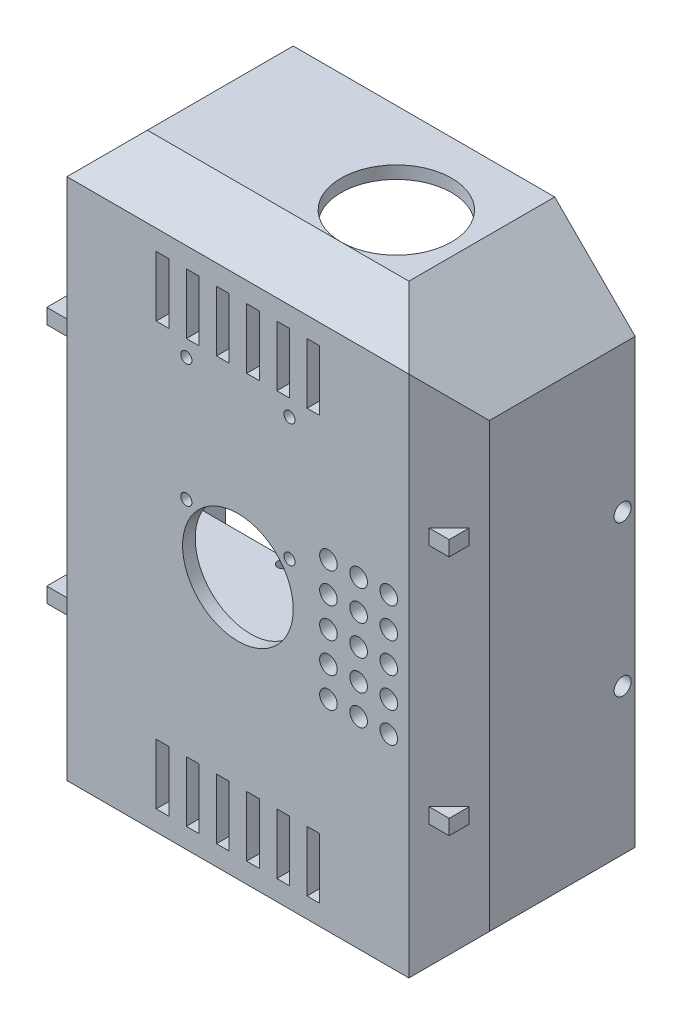
from build123d import *

# Parameters (mm, degrees)
BOSS_1_DEPTH    = 37
CUT_2_DEPTH     = 86
CUT_3_DEPTH     = 86
CUT_4_DEPTH     = 122
CUT_5_DEPTH     = 122
CUT_6_DEPTH     = 26.6
CUT_7_DEPTH     = 4.1
CUT_8_DEPTH     = 4.1
S_HOLE9_R       = 11
HOLE_9_DEPTH    = 2.7
S_CUT10_W       = 2.5
S_CUT10_H       = 12
POCKET_10_DEPTH = 2.7
S_CUT11_W       = 2.5
S_CUT11_H       = 12
POCKET_11_DEPTH = 2.7
S_CUT12_W       = 2.5
S_CUT12_H       = 12
POCKET_12_DEPTH = 2.7
S_CUT13_W       = 2.5
S_CUT13_H       = 12
POCKET_13_DEPTH = 2.7
S_CUT14_W       = 2.5
S_CUT14_H       = 12
POCKET_14_DEPTH = 2.7
S_CUT15_W       = 2.5
S_CUT15_H       = 12
POCKET_15_DEPTH = 2.7
S_HOLE16_R      = 1.7
HOLE_16_DEPTH   = 2.7
S_HOLE17_R      = 1.7
HOLE_17_DEPTH   = 2.7
S_HOLE18_R      = 11
HOLE_18_DEPTH   = 2.7
S_CUT19_W       = 2.5
S_CUT19_H       = 12
POCKET_19_DEPTH = 2.7
S_CUT20_W       = 2.5
S_CUT20_H       = 12
POCKET_20_DEPTH = 2.7
S_CUT21_W       = 2.5
S_CUT21_H       = 12
POCKET_21_DEPTH = 2.7
S_CUT22_W       = 2.5
S_CUT22_H       = 12
POCKET_22_DEPTH = 2.7
S_CUT23_W       = 2.5
S_CUT23_H       = 12
POCKET_23_DEPTH = 2.7
S_CUT24_W       = 2.5
S_CUT24_H       = 12
POCKET_24_DEPTH = 2.7
S_HOLE25_R      = 1.7
HOLE_25_DEPTH   = 2.7
S_HOLE26_R      = 1.7
HOLE_26_DEPTH   = 2.7
S_HOLE27_R      = 1.75
HOLE_27_DEPTH   = 2.7
S_HOLE28_R      = 1.75
HOLE_28_DEPTH   = 2.7
S_HOLE29_R      = 1.75
HOLE_29_DEPTH   = 2.7
S_HOLE30_R      = 1.75
HOLE_30_DEPTH   = 2.7
S_HOLE31_R      = 1.75
HOLE_31_DEPTH   = 2.7
S_HOLE32_R      = 1.75
HOLE_32_DEPTH   = 2.7
S_HOLE33_R      = 1.75
HOLE_33_DEPTH   = 2.7
S_HOLE34_R      = 1.75
HOLE_34_DEPTH   = 2.7
S_HOLE35_R      = 1.75
HOLE_35_DEPTH   = 2.7
S_HOLE36_R      = 1.75
HOLE_36_DEPTH   = 2.7
S_HOLE37_R      = 1.75
HOLE_37_DEPTH   = 2.7
S_HOLE38_R      = 1.75
HOLE_38_DEPTH   = 2.7
S_HOLE39_R      = 1.75
HOLE_39_DEPTH   = 2.7
S_HOLE40_R      = 1.75
HOLE_40_DEPTH   = 2.7
S_HOLE41_R      = 1.75
HOLE_41_DEPTH   = 2.7
S_HOLE42_R      = 11
HOLE_42_DEPTH   = 2.7
S_HOLE43_R      = 1.1
HOLE_43_DEPTH   = 2.7
S_HOLE44_R      = 1.1
HOLE_44_DEPTH   = 2.7
S_HOLE45_R      = 1.1
HOLE_45_DEPTH   = 2.7
S_HOLE46_R      = 1.1
HOLE_46_DEPTH   = 2.7
S_BOX47_W       = 80
S_BOX47_H       = 3
BOSS_47_DEPTH   = 28.5
S_BOX48_W       = 80
S_BOX48_H       = 3
BOSS_48_DEPTH   = 28.5
S_HOLE49_R      = 11
HOLE_49_DEPTH   = 3.2
S_HOLE50_R      = 1.1
HOLE_50_DEPTH   = 3.2
S_HOLE51_R      = 1.1
HOLE_51_DEPTH   = 3.2
S_HOLE52_R      = 1.1
HOLE_52_DEPTH   = 3.2
S_HOLE53_R      = 1.1
HOLE_53_DEPTH   = 3.2
S_HOLE54_R      = 11
HOLE_54_DEPTH   = 3.2
S_HOLE55_R      = 1.1
HOLE_55_DEPTH   = 3.2
S_HOLE56_R      = 1.1
HOLE_56_DEPTH   = 3.2
S_HOLE57_R      = 1.1
HOLE_57_DEPTH   = 3.2
S_HOLE58_R      = 1.1
HOLE_58_DEPTH   = 3.2


with BuildPart() as part:
    # S_prism1 → Boss_1 (new body)
    with BuildSketch(Plane.XY.offset(168)):
        Polygon((42, -44), (42, 44), (26, 60), (-26, 60), (-42, 44), (-42, -44), (-26, -60), (26, -60), align=None)
    extrude(amount=BOSS_1_DEPTH)

    # S_pcut2 → Cut_2 (cut)
    with BuildSketch(Plane(origin=(-43, 0, 0), x_dir=(0, 0, -1), z_dir=(1, 0, 0))):
        Polygon((-205.6, 60.6), (-205.6, 51.4), (-196.4, 60.6), align=None)
    extrude(amount=CUT_2_DEPTH, mode=Mode.SUBTRACT)

    # S_pcut3 → Cut_3 (cut)
    with BuildSketch(Plane(origin=(-43, 0, 0), x_dir=(0, 0, -1), z_dir=(1, 0, 0))):
        Polygon((-205.6, -60.6), (-205.6, -51.4), (-196.4, -60.6), align=None)
    extrude(amount=CUT_3_DEPTH, mode=Mode.SUBTRACT)

    # S_pcut4 → Cut_4 (cut)
    with BuildSketch(Plane(origin=(0, -61, 0), x_dir=(1, 0, 0), z_dir=(0, 1, 0))):
        Polygon((42.6, -205.6), (33.4, -205.6), (42.6, -196.4), align=None)
    extrude(amount=CUT_4_DEPTH, mode=Mode.SUBTRACT)

    # S_pcut5 → Cut_5 (cut)
    with BuildSketch(Plane(origin=(0, -61, 0), x_dir=(1, 0, 0), z_dir=(0, 1, 0))):
        Polygon((-42.6, -205.6), (-33.4, -205.6), (-42.6, -196.4), align=None)
    extrude(amount=CUT_5_DEPTH, mode=Mode.SUBTRACT)

    # S_pcut6 → Cut_6 (cut)
    with BuildSketch(Plane.XY.offset(167.9)):
        Polygon((39.5, -42.964466094), (39.5, 42.964466094), (24.964466094, 57.5), (-24.964466094, 57.5), (-39.5, 42.964466094), (-39.5, -42.964466094), (-24.964466094, -57.5), (24.964466094, -57.5), align=None)
    extrude(amount=CUT_6_DEPTH, mode=Mode.SUBTRACT)

    # S_pcut7 → Cut_7 (cut)
    with BuildSketch(Plane.XY.offset(194.4)):
        Polygon((35.5, -41.307611845), (35.5, 41.307611845), (23.307611845, 53.5), (-23.307611845, 53.5), (-35.5, 41.307611845), (-35.5, -41.307611845), (-23.307611845, -53.5), (23.307611845, -53.5), align=None)
    extrude(amount=CUT_7_DEPTH, mode=Mode.SUBTRACT)

    # S_pcut8 → Cut_8 (cut)
    with BuildSketch(Plane.XY.offset(198.4)):
        Polygon((31.5, -39.650757595), (31.5, 39.650757595), (21.650757595, 49.5), (-21.650757595, 49.5), (-31.5, 39.650757595), (-31.5, -39.650757595), (-21.650757595, -49.5), (21.650757595, -49.5), align=None)
    extrude(amount=CUT_8_DEPTH, mode=Mode.SUBTRACT)

    # S_hole9 → Hole_9 (cut)
    with BuildSketch(Plane(origin=(0, 57.4, 0), x_dir=(1, 0, 0), z_dir=(0, 1, 0))):
        with Locations((12.5, -186)):
            Circle(S_HOLE9_R)
    extrude(amount=HOLE_9_DEPTH, mode=Mode.SUBTRACT)

    # S_cut10 → Pocket_10 (cut)
    with BuildSketch(Plane.XY.offset(202.4)):
        with Locations((-15, 42)):
            Rectangle(S_CUT10_W, S_CUT10_H)
    extrude(amount=POCKET_10_DEPTH, mode=Mode.SUBTRACT)

    # S_cut11 → Pocket_11 (cut)
    with BuildSketch(Plane.XY.offset(202.4)):
        with Locations((-9, 42)):
            Rectangle(S_CUT11_W, S_CUT11_H)
    extrude(amount=POCKET_11_DEPTH, mode=Mode.SUBTRACT)

    # S_cut12 → Pocket_12 (cut)
    with BuildSketch(Plane.XY.offset(202.4)):
        with Locations((-3, 42)):
            Rectangle(S_CUT12_W, S_CUT12_H)
    extrude(amount=POCKET_12_DEPTH, mode=Mode.SUBTRACT)

    # S_cut13 → Pocket_13 (cut)
    with BuildSketch(Plane.XY.offset(202.4)):
        with Locations((3, 42)):
            Rectangle(S_CUT13_W, S_CUT13_H)
    extrude(amount=POCKET_13_DEPTH, mode=Mode.SUBTRACT)

    # S_cut14 → Pocket_14 (cut)
    with BuildSketch(Plane.XY.offset(202.4)):
        with Locations((9, 42)):
            Rectangle(S_CUT14_W, S_CUT14_H)
    extrude(amount=POCKET_14_DEPTH, mode=Mode.SUBTRACT)

    # S_cut15 → Pocket_15 (cut)
    with BuildSketch(Plane.XY.offset(202.4)):
        with Locations((15, 42)):
            Rectangle(S_CUT15_W, S_CUT15_H)
    extrude(amount=POCKET_15_DEPTH, mode=Mode.SUBTRACT)

    # S_hole16 → Hole_16 (cut)
    with BuildSketch(Plane(origin=(39.4, 0, 0), x_dir=(0, 0, -1), z_dir=(1, 0, 0))):
        with Locations((-170.5, -15)):
            Circle(S_HOLE16_R)
    extrude(amount=HOLE_16_DEPTH, mode=Mode.SUBTRACT)

    # S_hole17 → Hole_17 (cut)
    with BuildSketch(Plane(origin=(39.4, 0, 0), x_dir=(0, 0, -1), z_dir=(1, 0, 0))):
        with Locations((-170.5, 15)):
            Circle(S_HOLE17_R)
    extrude(amount=HOLE_17_DEPTH, mode=Mode.SUBTRACT)

    # S_hole18 → Hole_18 (cut)
    with BuildSketch(Plane(origin=(0, -60.1, 0), x_dir=(1, 0, 0), z_dir=(0, 1, 0))):
        with Locations((12.5, -186)):
            Circle(S_HOLE18_R)
    extrude(amount=HOLE_18_DEPTH, mode=Mode.SUBTRACT)

    # S_cut19 → Pocket_19 (cut)
    with BuildSketch(Plane.XY.offset(202.4)):
        with Locations((-15, -42)):
            Rectangle(S_CUT19_W, S_CUT19_H)
    extrude(amount=POCKET_19_DEPTH, mode=Mode.SUBTRACT)

    # S_cut20 → Pocket_20 (cut)
    with BuildSketch(Plane.XY.offset(202.4)):
        with Locations((-9, -42)):
            Rectangle(S_CUT20_W, S_CUT20_H)
    extrude(amount=POCKET_20_DEPTH, mode=Mode.SUBTRACT)

    # S_cut21 → Pocket_21 (cut)
    with BuildSketch(Plane.XY.offset(202.4)):
        with Locations((-3, -42)):
            Rectangle(S_CUT21_W, S_CUT21_H)
    extrude(amount=POCKET_21_DEPTH, mode=Mode.SUBTRACT)

    # S_cut22 → Pocket_22 (cut)
    with BuildSketch(Plane.XY.offset(202.4)):
        with Locations((3, -42)):
            Rectangle(S_CUT22_W, S_CUT22_H)
    extrude(amount=POCKET_22_DEPTH, mode=Mode.SUBTRACT)

    # S_cut23 → Pocket_23 (cut)
    with BuildSketch(Plane.XY.offset(202.4)):
        with Locations((9, -42)):
            Rectangle(S_CUT23_W, S_CUT23_H)
    extrude(amount=POCKET_23_DEPTH, mode=Mode.SUBTRACT)

    # S_cut24 → Pocket_24 (cut)
    with BuildSketch(Plane.XY.offset(202.4)):
        with Locations((15, -42)):
            Rectangle(S_CUT24_W, S_CUT24_H)
    extrude(amount=POCKET_24_DEPTH, mode=Mode.SUBTRACT)

    # S_hole25 → Hole_25 (cut)
    with BuildSketch(Plane(origin=(-42.1, 0, 0), x_dir=(0, 0, -1), z_dir=(1, 0, 0))):
        with Locations((-170.5, -15)):
            Circle(S_HOLE25_R)
    extrude(amount=HOLE_25_DEPTH, mode=Mode.SUBTRACT)

    # S_hole26 → Hole_26 (cut)
    with BuildSketch(Plane(origin=(-42.1, 0, 0), x_dir=(0, 0, -1), z_dir=(1, 0, 0))):
        with Locations((-170.5, 15)):
            Circle(S_HOLE26_R)
    extrude(amount=HOLE_26_DEPTH, mode=Mode.SUBTRACT)

    # S_hole27 → Hole_27 (cut)
    with BuildSketch(Plane.XY.offset(202.4)):
        with Locations((18, -12)):
            Circle(S_HOLE27_R)
    extrude(amount=HOLE_27_DEPTH, mode=Mode.SUBTRACT)

    # S_hole28 → Hole_28 (cut)
    with BuildSketch(Plane.XY.offset(202.4)):
        with Locations((18, -6)):
            Circle(S_HOLE28_R)
    extrude(amount=HOLE_28_DEPTH, mode=Mode.SUBTRACT)

    # S_hole29 → Hole_29 (cut)
    with BuildSketch(Plane.XY.offset(202.4)):
        with Locations((18, 0)):
            Circle(S_HOLE29_R)
    extrude(amount=HOLE_29_DEPTH, mode=Mode.SUBTRACT)

    # S_hole30 → Hole_30 (cut)
    with BuildSketch(Plane.XY.offset(202.4)):
        with Locations((18, 6)):
            Circle(S_HOLE30_R)
    extrude(amount=HOLE_30_DEPTH, mode=Mode.SUBTRACT)

    # S_hole31 → Hole_31 (cut)
    with BuildSketch(Plane.XY.offset(202.4)):
        with Locations((18, 12)):
            Circle(S_HOLE31_R)
    extrude(amount=HOLE_31_DEPTH, mode=Mode.SUBTRACT)

    # S_hole32 → Hole_32 (cut)
    with BuildSketch(Plane.XY.offset(202.4)):
        with Locations((24, -12)):
            Circle(S_HOLE32_R)
    extrude(amount=HOLE_32_DEPTH, mode=Mode.SUBTRACT)

    # S_hole33 → Hole_33 (cut)
    with BuildSketch(Plane.XY.offset(202.4)):
        with Locations((24, -6)):
            Circle(S_HOLE33_R)
    extrude(amount=HOLE_33_DEPTH, mode=Mode.SUBTRACT)

    # S_hole34 → Hole_34 (cut)
    with BuildSketch(Plane.XY.offset(202.4)):
        with Locations((24, 0)):
            Circle(S_HOLE34_R)
    extrude(amount=HOLE_34_DEPTH, mode=Mode.SUBTRACT)

    # S_hole35 → Hole_35 (cut)
    with BuildSketch(Plane.XY.offset(202.4)):
        with Locations((24, 6)):
            Circle(S_HOLE35_R)
    extrude(amount=HOLE_35_DEPTH, mode=Mode.SUBTRACT)

    # S_hole36 → Hole_36 (cut)
    with BuildSketch(Plane.XY.offset(202.4)):
        with Locations((24, 12)):
            Circle(S_HOLE36_R)
    extrude(amount=HOLE_36_DEPTH, mode=Mode.SUBTRACT)

    # S_hole37 → Hole_37 (cut)
    with BuildSketch(Plane.XY.offset(202.4)):
        with Locations((30, -12)):
            Circle(S_HOLE37_R)
    extrude(amount=HOLE_37_DEPTH, mode=Mode.SUBTRACT)

    # S_hole38 → Hole_38 (cut)
    with BuildSketch(Plane.XY.offset(202.4)):
        with Locations((30, -6)):
            Circle(S_HOLE38_R)
    extrude(amount=HOLE_38_DEPTH, mode=Mode.SUBTRACT)

    # S_hole39 → Hole_39 (cut)
    with BuildSketch(Plane.XY.offset(202.4)):
        with Locations((30, 0)):
            Circle(S_HOLE39_R)
    extrude(amount=HOLE_39_DEPTH, mode=Mode.SUBTRACT)

    # S_hole40 → Hole_40 (cut)
    with BuildSketch(Plane.XY.offset(202.4)):
        with Locations((30, 6)):
            Circle(S_HOLE40_R)
    extrude(amount=HOLE_40_DEPTH, mode=Mode.SUBTRACT)

    # S_hole41 → Hole_41 (cut)
    with BuildSketch(Plane.XY.offset(202.4)):
        with Locations((30, 12)):
            Circle(S_HOLE41_R)
    extrude(amount=HOLE_41_DEPTH, mode=Mode.SUBTRACT)

    # S_hole42 → Hole_42 (cut)
    with BuildSketch(Plane.XY.offset(202.4)):
        Circle(S_HOLE42_R)
    extrude(amount=HOLE_42_DEPTH, mode=Mode.SUBTRACT)

    # S_hole43 → Hole_43 (cut)
    with BuildSketch(Plane.XY.offset(202.4)):
        with Locations((-10.25, 8.3)):
            Circle(S_HOLE43_R)
    extrude(amount=HOLE_43_DEPTH, mode=Mode.SUBTRACT)

    # S_hole44 → Hole_44 (cut)
    with BuildSketch(Plane.XY.offset(202.4)):
        with Locations((10.25, 8.3)):
            Circle(S_HOLE44_R)
    extrude(amount=HOLE_44_DEPTH, mode=Mode.SUBTRACT)

    # S_hole45 → Hole_45 (cut)
    with BuildSketch(Plane.XY.offset(202.4)):
        with Locations((-10.25, 32.75)):
            Circle(S_HOLE45_R)
    extrude(amount=HOLE_45_DEPTH, mode=Mode.SUBTRACT)

    # S_hole46 → Hole_46 (cut)
    with BuildSketch(Plane.XY.offset(202.4)):
        with Locations((10.25, 32.75)):
            Circle(S_HOLE46_R)
    extrude(amount=HOLE_46_DEPTH, mode=Mode.SUBTRACT)

    # S_box47 → Boss_47 (add)
    with BuildSketch(Plane.XY.offset(174.5)):
        with Locations((0, 24)):
            Rectangle(S_BOX47_W, S_BOX47_H)
    extrude(amount=BOSS_47_DEPTH)

    # S_box48 → Boss_48 (add)
    with BuildSketch(Plane.XY.offset(174.5)):
        with Locations((0, -24)):
            Rectangle(S_BOX48_W, S_BOX48_H)
    extrude(amount=BOSS_48_DEPTH)

    # S_hole49 → Hole_49 (cut)
    with BuildSketch(Plane(origin=(0, 22.4, 0), x_dir=(1, 0, 0), z_dir=(0, 1, 0))):
        with Locations((12.5, -186)):
            Circle(S_HOLE49_R)
    extrude(amount=HOLE_49_DEPTH, mode=Mode.SUBTRACT)

    # S_hole50 → Hole_50 (cut)
    with BuildSketch(Plane(origin=(0, 22.4, 0), x_dir=(1, 0, 0), z_dir=(0, 1, 0))):
        with Locations((4.2, -175.75)):
            Circle(S_HOLE50_R)
    extrude(amount=HOLE_50_DEPTH, mode=Mode.SUBTRACT)

    # S_hole51 → Hole_51 (cut)
    with BuildSketch(Plane(origin=(0, 22.4, 0), x_dir=(1, 0, 0), z_dir=(0, 1, 0))):
        with Locations((4.2, -196.25)):
            Circle(S_HOLE51_R)
    extrude(amount=HOLE_51_DEPTH, mode=Mode.SUBTRACT)

    # S_hole52 → Hole_52 (cut)
    with BuildSketch(Plane(origin=(0, 22.4, 0), x_dir=(1, 0, 0), z_dir=(0, 1, 0))):
        with Locations((-20.25, -175.75)):
            Circle(S_HOLE52_R)
    extrude(amount=HOLE_52_DEPTH, mode=Mode.SUBTRACT)

    # S_hole53 → Hole_53 (cut)
    with BuildSketch(Plane(origin=(0, 22.4, 0), x_dir=(1, 0, 0), z_dir=(0, 1, 0))):
        with Locations((-20.25, -196.25)):
            Circle(S_HOLE53_R)
    extrude(amount=HOLE_53_DEPTH, mode=Mode.SUBTRACT)

    # S_hole54 → Hole_54 (cut)
    with BuildSketch(Plane(origin=(0, -25.6, 0), x_dir=(1, 0, 0), z_dir=(0, 1, 0))):
        with Locations((12.5, -186)):
            Circle(S_HOLE54_R)
    extrude(amount=HOLE_54_DEPTH, mode=Mode.SUBTRACT)

    # S_hole55 → Hole_55 (cut)
    with BuildSketch(Plane(origin=(0, -25.6, 0), x_dir=(1, 0, 0), z_dir=(0, 1, 0))):
        with Locations((4.2, -175.75)):
            Circle(S_HOLE55_R)
    extrude(amount=HOLE_55_DEPTH, mode=Mode.SUBTRACT)

    # S_hole56 → Hole_56 (cut)
    with BuildSketch(Plane(origin=(0, -25.6, 0), x_dir=(1, 0, 0), z_dir=(0, 1, 0))):
        with Locations((4.2, -196.25)):
            Circle(S_HOLE56_R)
    extrude(amount=HOLE_56_DEPTH, mode=Mode.SUBTRACT)

    # S_hole57 → Hole_57 (cut)
    with BuildSketch(Plane(origin=(0, -25.6, 0), x_dir=(1, 0, 0), z_dir=(0, 1, 0))):
        with Locations((-20.25, -175.75)):
            Circle(S_HOLE57_R)
    extrude(amount=HOLE_57_DEPTH, mode=Mode.SUBTRACT)

    # S_hole58 → Hole_58 (cut)
    with BuildSketch(Plane(origin=(0, -25.6, 0), x_dir=(1, 0, 0), z_dir=(0, 1, 0))):
        with Locations((-20.25, -196.25)):
            Circle(S_HOLE58_R)
    extrude(amount=HOLE_58_DEPTH, mode=Mode.SUBTRACT)


solid = part.part
